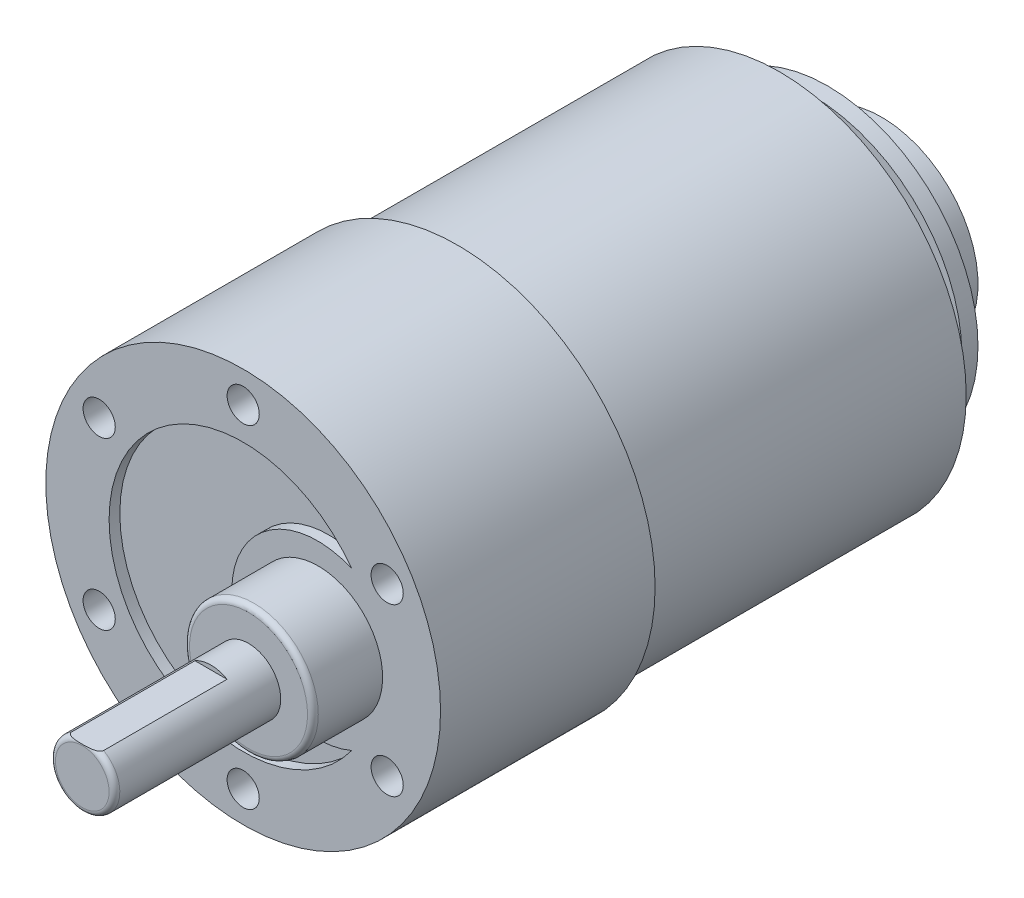
from build123d import *

# Parameters (mm, degrees)
SKETCH1_R                    = 18.4
BOSS_EXTRUDE1_DEPTH          = 20
SKETCH2_R                    = 17.4
BOSS_EXTRUDE2_DEPTH          = 30
SKETCH3_R                    = 6
BOSS_EXTRUDE3_DEPTH          = 6.5
FILLET1_R                    = 0.5
SKETCH4_R                    = 3
BOSS_EXTRUDE4_DEPTH          = 15.5
CUT_EXTRUDE1_START           = -12
CUT_EXTRUDE1_DEPTH           = 12
F_3_0_3_DIAMETER_HOLE1_D     = 3
F_3_0_3_DIAMETER_HOLE1_DEPTH = 3
F_3_0_3_DIAMETER_HOLE1_TIP   = 0.901290929
CUT_EXTRUDE2_DEPTH           = 1
SKETCH9_R                    = 4
BOSS_EXTRUDE5_DEPTH          = 1
FILLET2_R                    = 0.5
SKETCH10_R                   = 14
BOSS_EXTRUDE6_DEPTH          = 1.5
SKETCH11_W                   = 3.5
SKETCH11_H                   = 1
BOSS_EXTRUDE7_DEPTH          = 5.6
FILLET3_R                    = 0.5
SKETCH13_R                   = 9
BOSS_EXTRUDE8_DEPTH          = 3
SKETCH14_R                   = 1.5
BOSS_EXTRUDE9_DEPTH          = 8.55
FILLET4_R                    = 0.5


with BuildPart() as part:
    # Sketch1 → Boss-Extrude1 (new body)
    with BuildSketch(Plane.XY):
        Circle(SKETCH1_R)
    extrude(amount=BOSS_EXTRUDE1_DEPTH)

    # Sketch2 → Boss-Extrude2 (add)
    with BuildSketch(Plane(origin=(0, 0, 0), x_dir=(-1, 0, 0), z_dir=(0, 0, -1))):
        with Locations(Location((0, 0, 0), (0, 0, 180))):
            Circle(SKETCH2_R)
    extrude(amount=BOSS_EXTRUDE2_DEPTH)

    # Sketch3 → Boss-Extrude3 (add)
    with BuildSketch(Plane.XY.offset(20)):
        with Locations(Location((7, 0, 0), (0, 0, 180))):
            Circle(SKETCH3_R)
    extrude(amount=BOSS_EXTRUDE3_DEPTH)

    # Fillet1
    fillet1_edges = [part.edges().sort_by_distance(p)[0] for p in [
        (13, 0, 26.5),
    ]]
    fillet(fillet1_edges, radius=FILLET1_R)

    # Sketch4 → Boss-Extrude4 (add)
    with BuildSketch(Plane.XY.offset(26.5)):
        with Locations((7, 0)):
            Circle(SKETCH4_R)
    extrude(amount=BOSS_EXTRUDE4_DEPTH)

    # Sketch5 → Cut-Extrude1 (cut)
    with BuildSketch(Plane.XY.offset(42).offset(CUT_EXTRUDE1_START)):
        with BuildLine():
            Line((5.503337045, 2.6), (8.496662955, 2.6))
            ThreePointArc((8.496662955, 2.6), (7, 3), (5.503337045, 2.6))
        make_face()
    extrude(amount=CUT_EXTRUDE1_DEPTH, mode=Mode.SUBTRACT)

    # Ø3.0 (3) Diameter Hole1
    with Locations(Plane.XY.offset(20)):
        with Locations((-13.423393759, 7.75), (-13.423393759, -7.75), (0, -15.5), (13.423393759, 7.75), (0, 15.5), (13.423393759, -7.75)):
            Hole(F_3_0_3_DIAMETER_HOLE1_D / 2, depth=F_3_0_3_DIAMETER_HOLE1_DEPTH)
            with Locations((0, 0, -(F_3_0_3_DIAMETER_HOLE1_DEPTH + F_3_0_3_DIAMETER_HOLE1_TIP / 2))):  # 118° drill point
                Cone(0, F_3_0_3_DIAMETER_HOLE1_D / 2, F_3_0_3_DIAMETER_HOLE1_TIP, mode=Mode.SUBTRACT)

    # Sketch8 → Cut-Extrude2 (cut)
    with BuildSketch(Plane.XY.offset(20)):
        with BuildLine():
            ThreePointArc((10.116155685, 7.342574083), (-12.5, 0), (10.116155685, -7.342574083))
            ThreePointArc((10.116155685, -7.342574083), (-1.05978604, 0), (10.116155685, 7.342574083))
        make_face()
    extrude(amount=-CUT_EXTRUDE2_DEPTH, mode=Mode.SUBTRACT)

    # Sketch9 → Boss-Extrude5 (add)
    with BuildSketch(Plane(origin=(0, 0, -30), x_dir=(-1, 0, 0), z_dir=(0, 0, -1))):
        Circle(SKETCH9_R)
    extrude(amount=BOSS_EXTRUDE5_DEPTH)

    # Fillet2
    fillet2_edges = [part.edges().sort_by_distance(p)[0] for p in [
        (4, 0, -31),
    ]]
    fillet(fillet2_edges, radius=FILLET2_R)

    # Sketch11 → Boss-Extrude7 (add)
    with BuildSketch(Plane(origin=(0, 0, -30), x_dir=(-1, 0, 0), z_dir=(0, 0, -1))):
        with Locations((0, 12.05)):
            Rectangle(SKETCH11_W, SKETCH11_H)
        with Locations((0, -12.05)):
            Rectangle(SKETCH11_W, SKETCH11_H)
    extrude(amount=BOSS_EXTRUDE7_DEPTH)

    # Fillet3
    fillet3_edges = [part.edges().sort_by_distance(p)[0] for p in [
        (1.75, 12.05, -35.6),
        (-1.75, 12.05, -35.6),
        (-1.75, -12.05, -35.6),
        (1.75, -12.05, -35.6),
    ]]
    fillet(fillet3_edges, radius=FILLET3_R)

    # Sketch14 → Boss-Extrude9 (add)
    with BuildSketch(Plane(origin=(0, 0, -31), x_dir=(-1, 0, 0), z_dir=(0, 0, -1))):
        Circle(SKETCH14_R)
    extrude(amount=BOSS_EXTRUDE9_DEPTH)

    # Fillet4
    # the kernel refuses this fillet: 0.5 mm, written as the material it takes off along each edge
    with BuildSketch(Plane(origin=(7, 0, 42), x_dir=(0.4622655728594592, 0.8867415295050277, 0), z_dir=(0.8867415295050277, -0.4622655728594592, 0))) as fillet4_piece_1:
        with BuildLine():
            CenterArc((3 - FILLET4_R, -FILLET4_R), FILLET4_R, 0, 90)
            Line((3 - FILLET4_R, 0), (3 - FILLET4_R, FILLET4_R * 0.02))
            Line((3 - FILLET4_R, FILLET4_R * 0.02), (3 + FILLET4_R * 0.02, FILLET4_R * 0.02))
            Line((3 + FILLET4_R * 0.02, FILLET4_R * 0.02), (3 + FILLET4_R * 0.02, -FILLET4_R))
            Line((3 + FILLET4_R * 0.02, -FILLET4_R), (3, -FILLET4_R))
        make_face()
    revolve(axis=Axis((7, 0, 42), (0, 0, 1)), revolution_arc=297.533397677, mode=Mode.SUBTRACT)
    with BuildSketch(Plane(origin=(7, 0, 42), x_dir=(1, 0, 0), z_dir=(0, -1, 0))) as fillet4_piece_2:
        with BuildLine():
            CenterArc((3 - FILLET4_R, -FILLET4_R), FILLET4_R, 0, 90)
            Line((3 - FILLET4_R, 0), (3 - FILLET4_R, FILLET4_R * 0.02))
            Line((3 - FILLET4_R, FILLET4_R * 0.02), (3 + FILLET4_R * 0.02, FILLET4_R * 0.02))
            Line((3 + FILLET4_R * 0.02, FILLET4_R * 0.02), (3 + FILLET4_R * 0.02, -FILLET4_R))
            Line((3 + FILLET4_R * 0.02, -FILLET4_R), (3, -FILLET4_R))
        make_face()
    revolve(axis=Axis((7, 0, 42), (0, 0, 1)), revolution_arc=117.379597562, mode=Mode.SUBTRACT)


with BuildPart() as body_2:
    # Sketch10 → Boss-Extrude6 (new body)
    with BuildSketch(Plane(origin=(0, 0, -33), x_dir=(-1, 0, 0), z_dir=(0, 0, -1))):
        Circle(SKETCH10_R)
    extrude(amount=BOSS_EXTRUDE6_DEPTH)


with BuildPart() as body_3:
    # Sketch13 → Boss-Extrude8 (new body)
    with BuildSketch(Plane(origin=(0, 0, -36.5), x_dir=(-1, 0, 0), z_dir=(0, 0, -1))):
        Circle(SKETCH13_R)
    extrude(amount=BOSS_EXTRUDE8_DEPTH)


solid = Compound([part.part, body_2.part, body_3.part])
